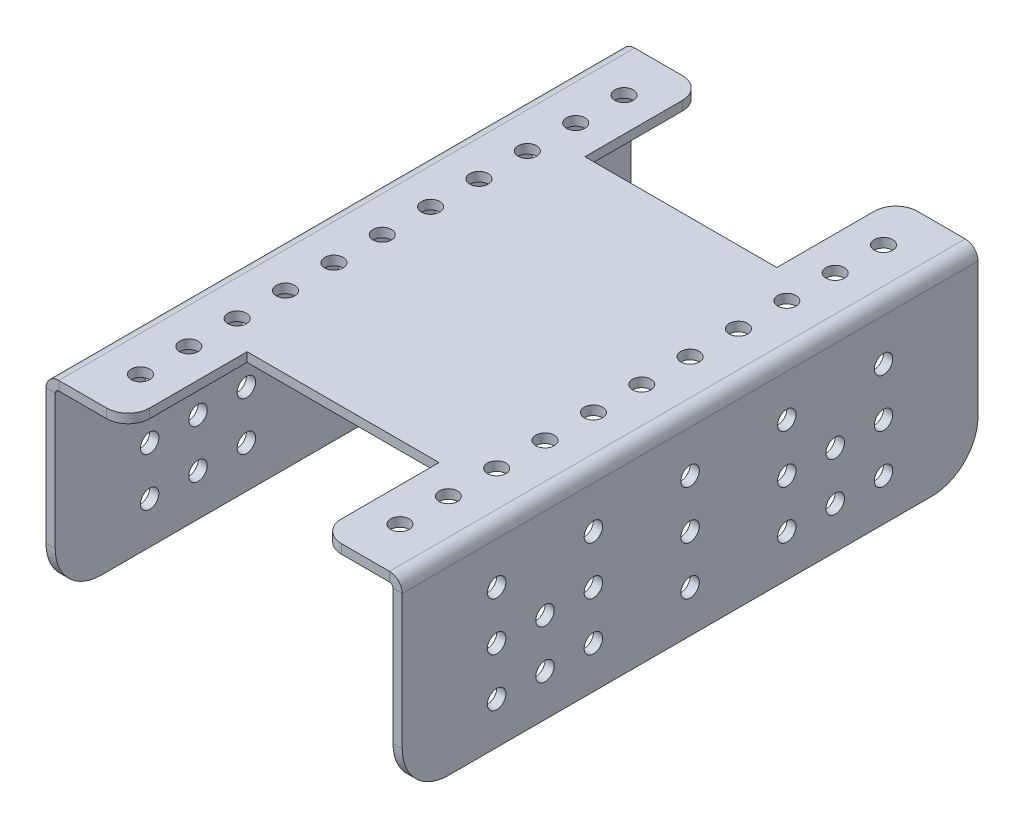
from build123d import *

# Parameters (mm, degrees)
BASE_FLANGE1_DEPTH            = 119.0625
SKETCH6_W                     = 39.6875
SKETCH6_H                     = 24.60625
CUT_EXTRUDE1_DEPTH            = 131.892046478
FILLET1_R                     = 4.445
FILLET2_R                     = 9.525
SKETCH7_R                     = 1.905
CUT_EXTRUDE2_DEPTH            = 146.0975
LPATTERN1_COUNT               = 2
LPATTERN1_PITCH               = 9.99998
LPATTERN2_COUNT               = 2
LPATTERN2_PITCH               = 9.99998
LPATTERN3_COUNT               = 3
LPATTERN3_PITCH               = 19.99996
LPATTERN3_COPY_1_SKETCH_R     = 1.905
LPATTERN3_COPY_1_DEPTH        = 146.0975
LPATTERN3_COPY_2_SKETCH_R     = 1.905
LPATTERN3_COPY_2_DEPTH        = 146.0975
LPATTERN4_COUNT               = 3
LPATTERN4_PITCH               = 19.99996
LPATTERN4_COPY_1_SKETCH_R     = 1.905
LPATTERN4_COPY_1_DEPTH        = 146.0975
LPATTERN4_COPY_2_SKETCH_R     = 1.905
LPATTERN4_COPY_2_DEPTH        = 146.0975
LPATTERN5_COPY_1_SKETCH_R     = 1.905
LPATTERN5_COPY_1_DEPTH        = 146.0975
LPATTERN5_COPY_2_SKETCH_R     = 1.905
LPATTERN5_COPY_2_DEPTH        = 146.0975
LPATTERN5_COPY_3_SKETCH_R     = 1.905
LPATTERN5_COPY_3_DEPTH        = 146.0975
LPATTERN5_COPY_4_SKETCH_R     = 1.905
LPATTERN5_COPY_4_DEPTH        = 146.0975
LPATTERN6_COPY_1_SKETCH_R     = 1.905
LPATTERN6_COPY_1_DEPTH        = 146.0975
LPATTERN6_COPY_2_SKETCH_R     = 1.905
LPATTERN6_COPY_2_DEPTH        = 146.0975
LPATTERN6_COPY_3_SKETCH_R     = 1.905
LPATTERN6_COPY_3_DEPTH        = 146.0975
LPATTERN6_COPY_4_SKETCH_R     = 1.905
LPATTERN6_COPY_4_DEPTH        = 146.0975
SKETCH8_R                     = 1.905
CUT_EXTRUDE3_DEPTH            = 1.905
LPATTERN7_COUNT               = 6
LPATTERN7_PITCH               = 9.99998
LPATTERN7_COL_COUNT           = 6
LPATTERN7_COL_PITCH           = 9.99998
MIRROR1_COPY_1_SKETCH_R       = 1.905
MIRROR1_COPY_1_DEPTH          = 1.905
MIRROR1_COPY_2_SKETCH_R       = 1.905
MIRROR1_COPY_2_DEPTH          = 1.905
MIRROR1_COPY_3_SKETCH_R       = 1.905
MIRROR1_COPY_3_DEPTH          = 1.905
MIRROR1_COPY_4_SKETCH_R       = 1.905
MIRROR1_COPY_4_DEPTH          = 1.905
MIRROR1_COPY_5_SKETCH_R       = 1.905
MIRROR1_COPY_5_DEPTH          = 1.905
MIRROR1_COPY_6_SKETCH_R       = 1.905
MIRROR1_COPY_6_DEPTH          = 1.905
MIRROR1_COPY_7_SKETCH_R       = 1.905
MIRROR1_COPY_7_DEPTH          = 1.905
MIRROR1_COPY_8_SKETCH_R       = 1.905
MIRROR1_COPY_8_DEPTH          = 1.905
MIRROR1_COPY_9_SKETCH_R       = 1.905
MIRROR1_COPY_9_DEPTH          = 1.905
MIRROR1_COPY_10_SKETCH_R      = 1.905
MIRROR1_COPY_10_DEPTH         = 1.905
LPATTERN8_COUNT               = 2
LPATTERN8_PITCH               = 29.99994
LPATTERN8_COPY_1_SKETCH_R     = 1.905
LPATTERN8_COPY_1_DEPTH        = 146.0975
LPATTERN8_COL_COUNT           = 2
LPATTERN8_COL_PITCH           = 29.99994
LPATTERN8_COL_COPY_1_SKETCH_R = 1.905
LPATTERN8_COL_COPY_1_DEPTH    = 146.0975


# Sheet-metal steps are written as plain solids
with BuildPart() as part:
    # Sketch1 → Base-Flange1 (new body)
    with BuildSketch(Plane.XY):
        with BuildLine():
            Line((-34.925, -38.1), (-34.925, -0.7366))
            ThreePointArc((-34.925, -0.7366), (-34.709254855, -0.215745145), (-34.1884, 0))
            Line((-34.1884, 0), (34.1884, 0))
            ThreePointArc((34.1884, 0), (34.709254855, -0.215745145), (34.925, -0.7366))
            Line((34.925, -0.7366), (34.925, -38.1))
            Line((34.925, -38.1), (36.83, -38.1))
            Line((36.83, -38.1), (36.83, -0.7366))
            ThreePointArc((36.83, -0.7366), (36.056293273, 1.131293273), (34.1884, 1.905))
            Line((34.1884, 1.905), (-34.1884, 1.905))
            ThreePointArc((-34.1884, 1.905), (-36.056293273, 1.131293273), (-36.83, -0.7366))
            Line((-36.83, -0.7366), (-36.83, -38.1))
            Line((-36.83, -38.1), (-34.925, -38.1))
        make_face()
    extrude(amount=BASE_FLANGE1_DEPTH)

    # Sketch6 → Cut-Extrude1 (cut, through all)
    with BuildSketch(Plane(origin=(0, 1.905, 0), x_dir=(1, 0, 0), z_dir=(0, 1, 0))):
        with Locations((-0.00635, -12.303125)):
            Rectangle(SKETCH6_W, SKETCH6_H)
        with Locations((-0.00635, -106.759375)):
            Rectangle(SKETCH6_W, SKETCH6_H)
    extrude(amount=-CUT_EXTRUDE1_DEPTH, mode=Mode.SUBTRACT)

    # Fillet1
    fillet1_edges = [part.edges().sort_by_distance(p)[0] for p in [
        (-19.8501, 0.9525, 0),
        (19.8374, 0.9525, 0),
        (19.8374, 0.9525, 119.0625),
        (-19.8501, 0.9525, 119.0625),
    ]]
    fillet(fillet1_edges, radius=FILLET1_R)

    # Fillet2
    fillet2_edges = [part.edges().sort_by_distance(p)[0] for p in [
        (35.8775, -38.1, 0),
        (-35.8775, -38.1, 0),
        (35.8775, -38.1, 119.0625),
        (-35.8775, -38.1, 119.0625),
    ]]
    fillet(fillet2_edges, radius=FILLET2_R)

    # Sketch7 → Cut-Extrude2 (cut, through all)
    with BuildSketch(Plane.ZY.offset(36.83)):
        with Locations((59.53125, -19.4183)):
            Circle(SKETCH7_R)
    cut_extrude2 = extrude(amount=-CUT_EXTRUDE2_DEPTH, mode=Mode.SUBTRACT)

    # LPattern1: Cut-Extrude2 ×2
    with Locations(*[(0, i * LPATTERN1_PITCH, 0) for i in range(1, LPATTERN1_COUNT)]):
        add(cut_extrude2, mode=Mode.SUBTRACT)

    # LPattern2: Cut-Extrude2 ×2
    with Locations(*[(0, -i * LPATTERN2_PITCH, 0) for i in range(1, LPATTERN2_COUNT)]):
        add(cut_extrude2, mode=Mode.SUBTRACT)

    # LPattern3: Cut-Extrude2 ×3
    with Locations(*[(0, 0, i * LPATTERN3_PITCH) for i in range(1, LPATTERN3_COUNT)]):
        add(cut_extrude2, mode=Mode.SUBTRACT)

    # LPattern3 copy 1 sketch → LPattern3 copy 1 (cut, through all)
    with BuildSketch(Plane(origin=(-36.83, -9.99998, 19.99996), x_dir=(0, 0, 1), z_dir=(-1, 0, 0))):
        with Locations((59.53125, -19.4183)):
            Circle(LPATTERN3_COPY_1_SKETCH_R)
    extrude(amount=-LPATTERN3_COPY_1_DEPTH, mode=Mode.SUBTRACT)

    # LPattern3 copy 2 sketch → LPattern3 copy 2 (cut, through all)
    with BuildSketch(Plane(origin=(-36.83, -9.99998, 39.99992), x_dir=(0, 0, 1), z_dir=(-1, 0, 0))):
        with Locations((59.53125, -19.4183)):
            Circle(LPATTERN3_COPY_2_SKETCH_R)
    extrude(amount=-LPATTERN3_COPY_2_DEPTH, mode=Mode.SUBTRACT)

    # LPattern4: Cut-Extrude2 ×3
    with Locations(*[(0, 0, -i * LPATTERN4_PITCH) for i in range(1, LPATTERN4_COUNT)]):
        add(cut_extrude2, mode=Mode.SUBTRACT)

    # LPattern4 copy 1 sketch → LPattern4 copy 1 (cut, through all)
    with BuildSketch(Plane(origin=(-36.83, -9.99998, -19.99996), x_dir=(0, 0, 1), z_dir=(-1, 0, 0))):
        with Locations((59.53125, -19.4183)):
            Circle(LPATTERN4_COPY_1_SKETCH_R)
    extrude(amount=-LPATTERN4_COPY_1_DEPTH, mode=Mode.SUBTRACT)

    # LPattern4 copy 2 sketch → LPattern4 copy 2 (cut, through all)
    with BuildSketch(Plane(origin=(-36.83, -9.99998, -39.99992), x_dir=(0, 0, 1), z_dir=(-1, 0, 0))):
        with Locations((59.53125, -19.4183)):
            Circle(LPATTERN4_COPY_2_SKETCH_R)
    extrude(amount=-LPATTERN4_COPY_2_DEPTH, mode=Mode.SUBTRACT)

    # LPattern5 copy 1 sketch → LPattern5 copy 1 (cut, through all)
    with BuildSketch(Plane(origin=(-36.83, 9.99998, -19.99996), x_dir=(0, 0, 1), z_dir=(-1, 0, 0))):
        with Locations((59.53125, -19.4183)):
            Circle(LPATTERN5_COPY_1_SKETCH_R)
    extrude(amount=-LPATTERN5_COPY_1_DEPTH, mode=Mode.SUBTRACT)

    # LPattern5 copy 2 sketch → LPattern5 copy 2 (cut, through all)
    with BuildSketch(Plane(origin=(-36.83, 9.99998, -39.99992), x_dir=(0, 0, 1), z_dir=(-1, 0, 0))):
        with Locations((59.53125, -19.4183)):
            Circle(LPATTERN5_COPY_2_SKETCH_R)
    extrude(amount=-LPATTERN5_COPY_2_DEPTH, mode=Mode.SUBTRACT)

    # LPattern5 copy 3 sketch → LPattern5 copy 3 (cut, through all)
    with BuildSketch(Plane(origin=(-36.83, 0, -19.99996), x_dir=(0, 0, 1), z_dir=(-1, 0, 0))):
        with Locations((59.53125, -19.4183)):
            Circle(LPATTERN5_COPY_3_SKETCH_R)
    extrude(amount=-LPATTERN5_COPY_3_DEPTH, mode=Mode.SUBTRACT)

    # LPattern5 copy 4 sketch → LPattern5 copy 4 (cut, through all)
    with BuildSketch(Plane(origin=(-36.83, 0, -39.99992), x_dir=(0, 0, 1), z_dir=(-1, 0, 0))):
        with Locations((59.53125, -19.4183)):
            Circle(LPATTERN5_COPY_4_SKETCH_R)
    extrude(amount=-LPATTERN5_COPY_4_DEPTH, mode=Mode.SUBTRACT)

    # LPattern6 copy 1 sketch → LPattern6 copy 1 (cut, through all)
    with BuildSketch(Plane(origin=(-36.83, 9.99998, 19.99996), x_dir=(0, 0, 1), z_dir=(-1, 0, 0))):
        with Locations((59.53125, -19.4183)):
            Circle(LPATTERN6_COPY_1_SKETCH_R)
    extrude(amount=-LPATTERN6_COPY_1_DEPTH, mode=Mode.SUBTRACT)

    # LPattern6 copy 2 sketch → LPattern6 copy 2 (cut, through all)
    with BuildSketch(Plane(origin=(-36.83, 9.99998, 39.99992), x_dir=(0, 0, 1), z_dir=(-1, 0, 0))):
        with Locations((59.53125, -19.4183)):
            Circle(LPATTERN6_COPY_2_SKETCH_R)
    extrude(amount=-LPATTERN6_COPY_2_DEPTH, mode=Mode.SUBTRACT)

    # LPattern6 copy 3 sketch → LPattern6 copy 3 (cut, through all)
    with BuildSketch(Plane(origin=(-36.83, 0, 19.99996), x_dir=(0, 0, 1), z_dir=(-1, 0, 0))):
        with Locations((59.53125, -19.4183)):
            Circle(LPATTERN6_COPY_3_SKETCH_R)
    extrude(amount=-LPATTERN6_COPY_3_DEPTH, mode=Mode.SUBTRACT)

    # LPattern6 copy 4 sketch → LPattern6 copy 4 (cut, through all)
    with BuildSketch(Plane(origin=(-36.83, 0, 39.99992), x_dir=(0, 0, 1), z_dir=(-1, 0, 0))):
        with Locations((59.53125, -19.4183)):
            Circle(LPATTERN6_COPY_4_SKETCH_R)
    extrude(amount=-LPATTERN6_COPY_4_DEPTH, mode=Mode.SUBTRACT)

    # Sketch8 → Cut-Extrude3 (cut)
    with BuildSketch(Plane(origin=(0, 1.905, 0), x_dir=(1, 0, 0), z_dir=(0, 1, 0))):
        with Locations(Location((-26.83002, -59.53125, 0), (0, 0, 270))):
            Circle(SKETCH8_R)
    cut_extrude3 = extrude(amount=-CUT_EXTRUDE3_DEPTH, mode=Mode.SUBTRACT)

    # LPattern7: Cut-Extrude3 ×6
    with Locations(*[(0, 0, i * LPATTERN7_PITCH) for i in range(1, LPATTERN7_COUNT)]):
        add(cut_extrude3, mode=Mode.SUBTRACT)

    # LPattern7 col: Cut-Extrude3 ×6
    with Locations(*[(0, 0, -i * LPATTERN7_COL_PITCH) for i in range(1, LPATTERN7_COL_COUNT)]):
        add(cut_extrude3, mode=Mode.SUBTRACT)

    # Mirror1: Cut-Extrude3 across plane
    add(cut_extrude3.mirror(Plane(origin=(0, 0, 0), x_dir=(0, 0, 1), z_dir=(1, 0, 0))), mode=Mode.SUBTRACT)

    # Mirror1 copy 1 sketch → Mirror1 copy 1 (cut)
    with BuildSketch(Plane(origin=(0, 1.905, 9.99998), x_dir=(-1, 0, 0), z_dir=(0, 1, 0))):
        with Locations((-26.83002, 59.53125)):
            Circle(MIRROR1_COPY_1_SKETCH_R)
    extrude(amount=-MIRROR1_COPY_1_DEPTH, mode=Mode.SUBTRACT)

    # Mirror1 copy 2 sketch → Mirror1 copy 2 (cut)
    with BuildSketch(Plane(origin=(0, 1.905, 19.99996), x_dir=(-1, 0, 0), z_dir=(0, 1, 0))):
        with Locations((-26.83002, 59.53125)):
            Circle(MIRROR1_COPY_2_SKETCH_R)
    extrude(amount=-MIRROR1_COPY_2_DEPTH, mode=Mode.SUBTRACT)

    # Mirror1 copy 3 sketch → Mirror1 copy 3 (cut)
    with BuildSketch(Plane(origin=(0, 1.905, 29.99994), x_dir=(-1, 0, 0), z_dir=(0, 1, 0))):
        with Locations((-26.83002, 59.53125)):
            Circle(MIRROR1_COPY_3_SKETCH_R)
    extrude(amount=-MIRROR1_COPY_3_DEPTH, mode=Mode.SUBTRACT)

    # Mirror1 copy 4 sketch → Mirror1 copy 4 (cut)
    with BuildSketch(Plane(origin=(0, 1.905, 39.99992), x_dir=(-1, 0, 0), z_dir=(0, 1, 0))):
        with Locations((-26.83002, 59.53125)):
            Circle(MIRROR1_COPY_4_SKETCH_R)
    extrude(amount=-MIRROR1_COPY_4_DEPTH, mode=Mode.SUBTRACT)

    # Mirror1 copy 5 sketch → Mirror1 copy 5 (cut)
    with BuildSketch(Plane(origin=(0, 1.905, 49.9999), x_dir=(-1, 0, 0), z_dir=(0, 1, 0))):
        with Locations((-26.83002, 59.53125)):
            Circle(MIRROR1_COPY_5_SKETCH_R)
    extrude(amount=-MIRROR1_COPY_5_DEPTH, mode=Mode.SUBTRACT)

    # Mirror1 copy 6 sketch → Mirror1 copy 6 (cut)
    with BuildSketch(Plane(origin=(0, 1.905, -9.99998), x_dir=(-1, 0, 0), z_dir=(0, 1, 0))):
        with Locations((-26.83002, 59.53125)):
            Circle(MIRROR1_COPY_6_SKETCH_R)
    extrude(amount=-MIRROR1_COPY_6_DEPTH, mode=Mode.SUBTRACT)

    # Mirror1 copy 7 sketch → Mirror1 copy 7 (cut)
    with BuildSketch(Plane(origin=(0, 1.905, -19.99996), x_dir=(-1, 0, 0), z_dir=(0, 1, 0))):
        with Locations((-26.83002, 59.53125)):
            Circle(MIRROR1_COPY_7_SKETCH_R)
    extrude(amount=-MIRROR1_COPY_7_DEPTH, mode=Mode.SUBTRACT)

    # Mirror1 copy 8 sketch → Mirror1 copy 8 (cut)
    with BuildSketch(Plane(origin=(0, 1.905, -29.99994), x_dir=(-1, 0, 0), z_dir=(0, 1, 0))):
        with Locations((-26.83002, 59.53125)):
            Circle(MIRROR1_COPY_8_SKETCH_R)
    extrude(amount=-MIRROR1_COPY_8_DEPTH, mode=Mode.SUBTRACT)

    # Mirror1 copy 9 sketch → Mirror1 copy 9 (cut)
    with BuildSketch(Plane(origin=(0, 1.905, -39.99992), x_dir=(-1, 0, 0), z_dir=(0, 1, 0))):
        with Locations((-26.83002, 59.53125)):
            Circle(MIRROR1_COPY_9_SKETCH_R)
    extrude(amount=-MIRROR1_COPY_9_DEPTH, mode=Mode.SUBTRACT)

    # Mirror1 copy 10 sketch → Mirror1 copy 10 (cut)
    with BuildSketch(Plane(origin=(0, 1.905, -49.9999), x_dir=(-1, 0, 0), z_dir=(0, 1, 0))):
        with Locations((-26.83002, 59.53125)):
            Circle(MIRROR1_COPY_10_SKETCH_R)
    extrude(amount=-MIRROR1_COPY_10_DEPTH, mode=Mode.SUBTRACT)

    # LPattern8: Cut-Extrude2 ×2
    with Locations(*[(0, 0, i * LPATTERN8_PITCH) for i in range(1, LPATTERN8_COUNT)]):
        add(cut_extrude2, mode=Mode.SUBTRACT)

    # LPattern8 copy 1 sketch → LPattern8 copy 1 (cut, through all)
    with BuildSketch(Plane(origin=(-36.83, -9.99998, 29.99994), x_dir=(0, 0, 1), z_dir=(-1, 0, 0))):
        with Locations((59.53125, -19.4183)):
            Circle(LPATTERN8_COPY_1_SKETCH_R)
    extrude(amount=-LPATTERN8_COPY_1_DEPTH, mode=Mode.SUBTRACT)

    # LPattern8 col: Cut-Extrude2 ×2
    with Locations(*[(0, 0, -i * LPATTERN8_COL_PITCH) for i in range(1, LPATTERN8_COL_COUNT)]):
        add(cut_extrude2, mode=Mode.SUBTRACT)

    # LPattern8 col copy 1 sketch → LPattern8 col copy 1 (cut, through all)
    with BuildSketch(Plane(origin=(-36.83, -9.99998, -29.99994), x_dir=(0, 0, 1), z_dir=(-1, 0, 0))):
        with Locations((59.53125, -19.4183)):
            Circle(LPATTERN8_COL_COPY_1_SKETCH_R)
    extrude(amount=-LPATTERN8_COL_COPY_1_DEPTH, mode=Mode.SUBTRACT)


solid = part.part
